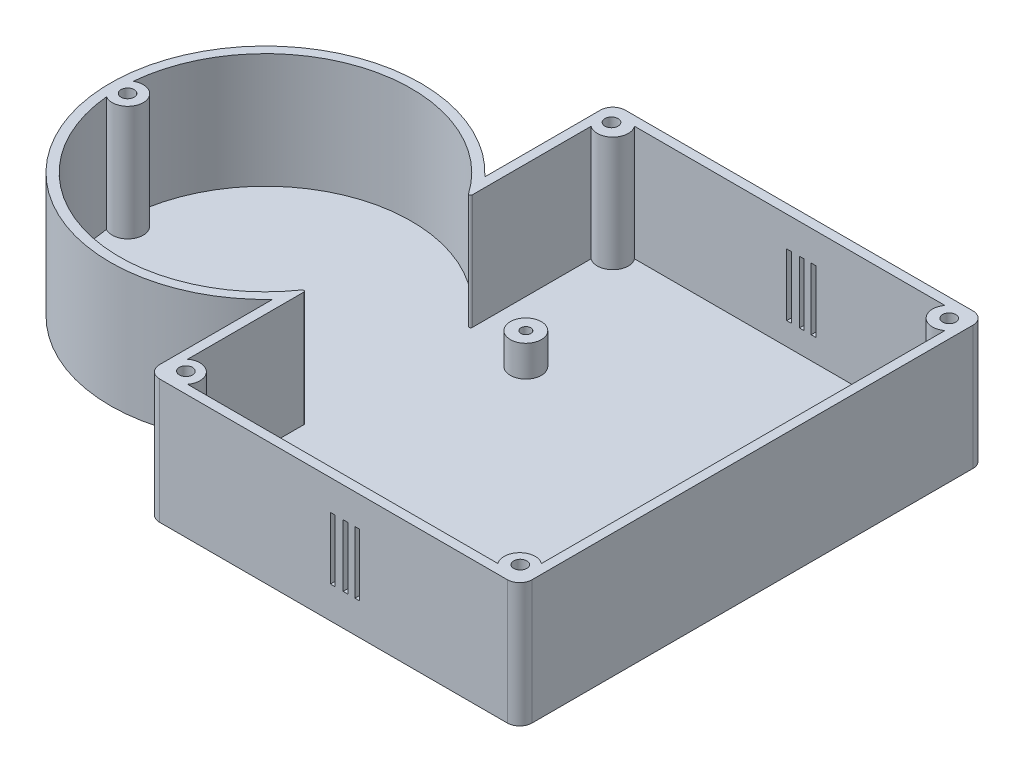
from build123d import *

# Parameters (mm, degrees)
SKETCH8_W                      = 120
SKETCH8_H                      = 150
BOSS_EXTRUDE3_DEPTH            = 40
SKETCH9_R                      = 50
BOSS_EXTRUDE4_DEPTH            = 40
SHELL1_START                   = 3
SHELL1_DEPTH                   = 37
FILLET2_R                      = 0.5
SKETCH17_R                     = 5
BOSS_EXTRUDE6_DEPTH            = 10
CUT_EXTRUDE9_DEPTH             = 203.818558951
CUT_EXTRUDE9_DEPTH_BACK        = 203.818558951
SKETCH11_W                     = 1.5
SKETCH11_H                     = 20
CUT_EXTRUDE10_DEPTH            = 205.88547515
CUT_EXTRUDE10_DEPTH_BACK       = 205.88547515
SKETCH12_W                     = 1.5
SKETCH12_H                     = 20
CUT_EXTRUDE11_DEPTH            = 203.818558951
CUT_EXTRUDE11_DEPTH_BACK       = 203.818558951
SKETCH15_W                     = 1.5
SKETCH15_H                     = 20
SKETCH28_R                     = 5
BOSS_EXTRUDE7_DEPTH            = 37
SKETCH29_R                     = 5
BOSS_EXTRUDE8_DEPTH            = 40
SKETCH30_R                     = 5
BOSS_EXTRUDE9_DEPTH            = 40
SKETCH31_R                     = 5
BOSS_EXTRUDE10_DEPTH           = 37
SKETCH32_R                     = 5
BOSS_EXTRUDE11_DEPTH           = 37
F_2_0_221_DIAMETER_HOLE1_D     = 4.25
F_2_0_221_DIAMETER_HOLE1_DEPTH = 8
F_2_0_221_DIAMETER_HOLE1_TIP   = 1.276828815
F_2_0_221_DIAMETER_HOLE2_D     = 3.2
F_2_0_221_DIAMETER_HOLE2_DEPTH = 6
F_2_0_221_DIAMETER_HOLE2_TIP   = 0.96137699
FILLET3_R                      = 4


# Read off the part's stored shape, not the designer's step: Shell1
with BuildPart() as part:
    # Sketch8 → Boss-Extrude3 (new body)
    with BuildSketch(Plane(origin=(0, 0, 0), x_dir=(1, 0, 0), z_dir=(0, 1, 0))):
        with Locations((73.708855083, 72.164227744)):
            Rectangle(SKETCH8_W, SKETCH8_H)
    extrude(amount=BOSS_EXTRUDE3_DEPTH)

    # Sketch9 → Boss-Extrude4 (add)
    with BuildSketch(Plane(origin=(0, 0, 0), x_dir=(1, 0, 0), z_dir=(0, 1, 0))):
        with Locations((-22.779007595, 71.748458752)):
            Circle(SKETCH9_R)
    extrude(amount=BOSS_EXTRUDE4_DEPTH)

    # Shell1 outline → Shell1 (cut)
    with BuildSketch(Plane(origin=(0, 0, 0), x_dir=(1, 0, 0), z_dir=(0, 1, 0)).offset(SHELL1_START)):
        with BuildLine():
            Line((16.708855083, 46.259074664), (16.708855083, 0.164227744))
            Line((16.708855083, 0.164227744), (130.708855083, 0.164227744))
            Line((130.708855083, 0.164227744), (130.708855083, 144.164227744))
            Line((130.708855083, 144.164227744), (16.708855083, 144.164227744))
            Line((16.708855083, 144.164227744), (16.708855083, 97.237842839))
            ThreePointArc((16.708855083, 97.237842839), (-69.779007595, 71.748458751), (16.708855083, 46.259074664))
        make_face()
    extrude(amount=SHELL1_DEPTH, mode=Mode.SUBTRACT)

    # Fillet2
    fillet2_edges = [part.edges().sort_by_distance(p)[0] for p in [
        (16.708855083, 21.5, -46.259074664),
        (16.708855083, 21.5, -97.237842839),
    ]]
    fillet(fillet2_edges, radius=FILLET2_R)

    # Sketch17 → Boss-Extrude6 (add)
    with BuildSketch(Plane(origin=(1.848761015, 3, -2.465014687), x_dir=(1, 0, 0), z_dir=(0, 1, 0))):
        with Locations(Location((111.867013496, 11.175325825, 0), (0, 0, 270))):
            Circle(SKETCH17_R)
        with Locations(Location((34.367013496, 11.175325825, 0), (0, 0, 270))):
            Circle(SKETCH17_R)
        with Locations(Location((111.867013496, 94.175325825, 0), (0, 0, 270))):
            Circle(SKETCH17_R)
        with Locations(Location((34.367013496, 94.175325825, 0), (0, 0, 270))):
            Circle(SKETCH17_R)
    extrude(amount=BOSS_EXTRUDE6_DEPTH)

    # Sketch11 → Cut-Extrude9 (cut, two sides: drawn at the far end of the back side and taken through both)
    with BuildSketch(Plane.XY.offset(-CUT_EXTRUDE9_DEPTH_BACK)):
        with Locations((73.491480368, 20.290686907)):
            Rectangle(SKETCH11_W, SKETCH11_H)
    extrude(amount=CUT_EXTRUDE9_DEPTH + CUT_EXTRUDE9_DEPTH_BACK, mode=Mode.SUBTRACT)

    # Sketch12 → Cut-Extrude10 (cut, two sides: drawn at the far end of the back side and taken through both)
    with BuildSketch(Plane.XY.offset(2.835772256).offset(-CUT_EXTRUDE10_DEPTH_BACK)):
        with Locations((77.588922832, 20.290686907)):
            Rectangle(SKETCH12_W, SKETCH12_H)
    extrude(amount=CUT_EXTRUDE10_DEPTH + CUT_EXTRUDE10_DEPTH_BACK, mode=Mode.SUBTRACT)

    # Sketch15 → Cut-Extrude11 (cut, two sides: drawn at the far end of the back side and taken through both)
    with BuildSketch(Plane.XY.offset(-CUT_EXTRUDE11_DEPTH_BACK)):
        with Locations((81.379057112, 20.290686907)):
            Rectangle(SKETCH15_W, SKETCH15_H)
    extrude(amount=CUT_EXTRUDE11_DEPTH + CUT_EXTRUDE11_DEPTH_BACK, mode=Mode.SUBTRACT)

    # Sketch28 → Boss-Extrude7 (add)
    with BuildSketch(Plane(origin=(0, 3, 0), x_dir=(1, 0, 0), z_dir=(0, 1, 0))):
        with Locations((19.708855083, 141.164227744)):
            Circle(SKETCH28_R)
    extrude(amount=BOSS_EXTRUDE7_DEPTH)

    # Sketch29 → Boss-Extrude8 (add)
    with BuildSketch(Plane(origin=(0, 0, 0), x_dir=(1, 0, 0), z_dir=(0, 1, 0))):
        with Locations((19.708855083, 3.164227744)):
            Circle(SKETCH29_R)
    extrude(amount=BOSS_EXTRUDE8_DEPTH)

    # Sketch30 → Boss-Extrude9 (add)
    with BuildSketch(Plane(origin=(0, 0, 0), x_dir=(1, 0, 0), z_dir=(0, 1, 0))):
        with Locations((127.708855083, 141.164227744)):
            Circle(SKETCH30_R)
    extrude(amount=BOSS_EXTRUDE9_DEPTH)

    # Sketch31 → Boss-Extrude10 (add)
    with BuildSketch(Plane(origin=(0, 3, 0), x_dir=(1, 0, 0), z_dir=(0, 1, 0))):
        with Locations((127.708855083, 3.164227744)):
            Circle(SKETCH31_R)
    extrude(amount=BOSS_EXTRUDE10_DEPTH)

    # Sketch32 → Boss-Extrude11 (add)
    with BuildSketch(Plane(origin=(0, 3, 0), x_dir=(1, 0, 0), z_dir=(0, 1, 0))):
        with Locations((-67.018543515, 71.628998297)):
            Circle(SKETCH32_R)
    extrude(amount=BOSS_EXTRUDE11_DEPTH)

    # #2 (0.221) Diameter Hole1
    with Locations(Plane(origin=(0, 40, 0), x_dir=(1, 0, 0), z_dir=(0, 1, 0))):
        with Locations((18.917123201, 141.531370062), (127.969984407, 141.269223761), (127.602547564, 3.45328248), (19.774147178, 3.570575466), (-67.115618064, 71.668740496)):
            Hole(F_2_0_221_DIAMETER_HOLE1_D / 2, depth=F_2_0_221_DIAMETER_HOLE1_DEPTH)
            with Locations((0, 0, -(F_2_0_221_DIAMETER_HOLE1_DEPTH + F_2_0_221_DIAMETER_HOLE1_TIP / 2))):  # 118° drill point
                Cone(0, F_2_0_221_DIAMETER_HOLE1_D / 2, F_2_0_221_DIAMETER_HOLE1_TIP, mode=Mode.SUBTRACT)

    # #2 (0.221) Diameter Hole2
    with Locations(Plane(origin=(0, 13, 0), x_dir=(1, 0, 0), z_dir=(0, 1, 0))):
        with Locations((113.866576204, 96.665654076), (36.269140625, 13.672370328), (113.866576204, 13.415425177), (36.224664422, 96.637257854)):
            Hole(F_2_0_221_DIAMETER_HOLE2_D / 2, depth=F_2_0_221_DIAMETER_HOLE2_DEPTH)
            with Locations((0, 0, -(F_2_0_221_DIAMETER_HOLE2_DEPTH + F_2_0_221_DIAMETER_HOLE2_TIP / 2))):  # 118° drill point
                Cone(0, F_2_0_221_DIAMETER_HOLE2_D / 2, F_2_0_221_DIAMETER_HOLE2_TIP, mode=Mode.SUBTRACT)

    # Fillet3
    fillet3_edges = [part.edges().sort_by_distance(p)[0] for p in [
        (13.708855083, 20, -147.164227744),
        (133.708855083, 20, -147.164227744),
        (133.708855083, 20, 2.835772256),
        (13.708855083, 20, 2.835772256),
    ]]
    fillet(fillet3_edges, radius=FILLET3_R)


solid = part.part
